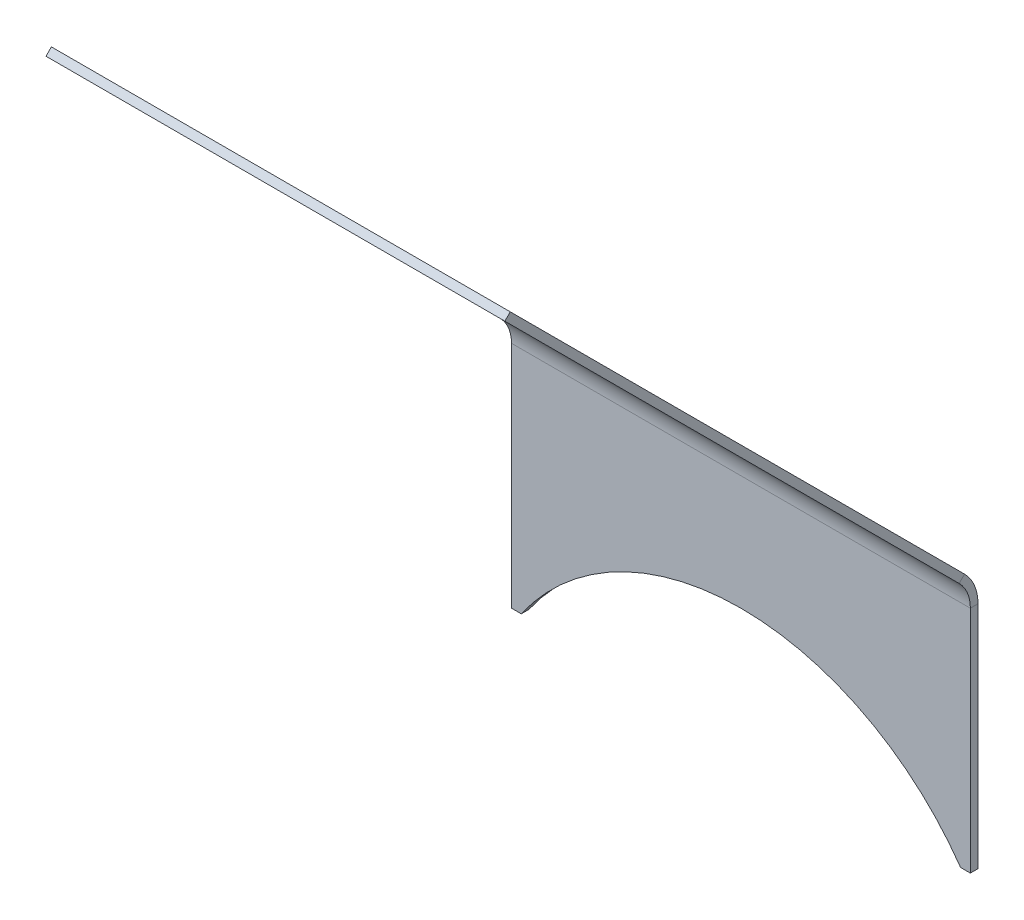
from build123d import *

# Parameters (mm, degrees)
SKETCH_2_W             = 120
SKETCH_2_H             = 60
SM_BASE_FLANGE_1_DEPTH = 2
SM_EDGE_FLANGE_1_DEPTH = 120
CUT_EXTRUDE_3_REACH    = 256.546
SKETCH_3_R             = 70


# Sheet-metal steps are written as plain solids
with BuildPart() as part:
    # Sketch 2 → Базовая кромка1 (new body)
    with BuildSketch(Plane.XY):
        with Locations((60, 30)):
            Rectangle(SKETCH_2_W, SKETCH_2_H)
    extrude(amount=SM_BASE_FLANGE_1_DEPTH)

    # Ребро-кромка1 section (across the edge) → Ребро-кромка1 (add)
    with BuildSketch(Plane(origin=(120, 64.142135624, 2), x_dir=(0, -0.7071067811865438, 0.7071067811865512), z_dir=(-1, 0, 0))):
        with BuildLine():
            Line((-2, 4.142135624), (-2, 172.171572875))
            Line((-2, 172.171572875), (0, 172.171572875))
            Line((0, 172.171572875), (0, 4.142135624))
            ThreePointArc((0, 4.142135624), (0.761204675, 0.3153013), (2.928932188, -2.928932188))
            Line((2.928932188, -2.928932188), (1.514718626, -4.343145751))
            ThreePointArc((1.514718626, -4.343145751), (-1.08655439, -0.450065565), (-2, 4.142135624))
        make_face()
    extrude(amount=SM_EDGE_FLANGE_1_DEPTH)

    # Эскиз3 → Вырез-Вытянуть3 (cut, up to next)
    with BuildSketch(Plane.XY, mode=Mode.PRIVATE) as cut_extrude_3_sk1:
        with Locations((60, -40)):
            Circle(SKETCH_3_R)
    cut_extrude_3_tool1 = extrude(cut_extrude_3_sk1.sketch, amount=CUT_EXTRUDE_3_REACH, mode=Mode.PRIVATE) & part.part
    add(cut_extrude_3_tool1.solids().sort_by_distance((60, -40, 0))[0], mode=Mode.SUBTRACT)


solid = part.part
